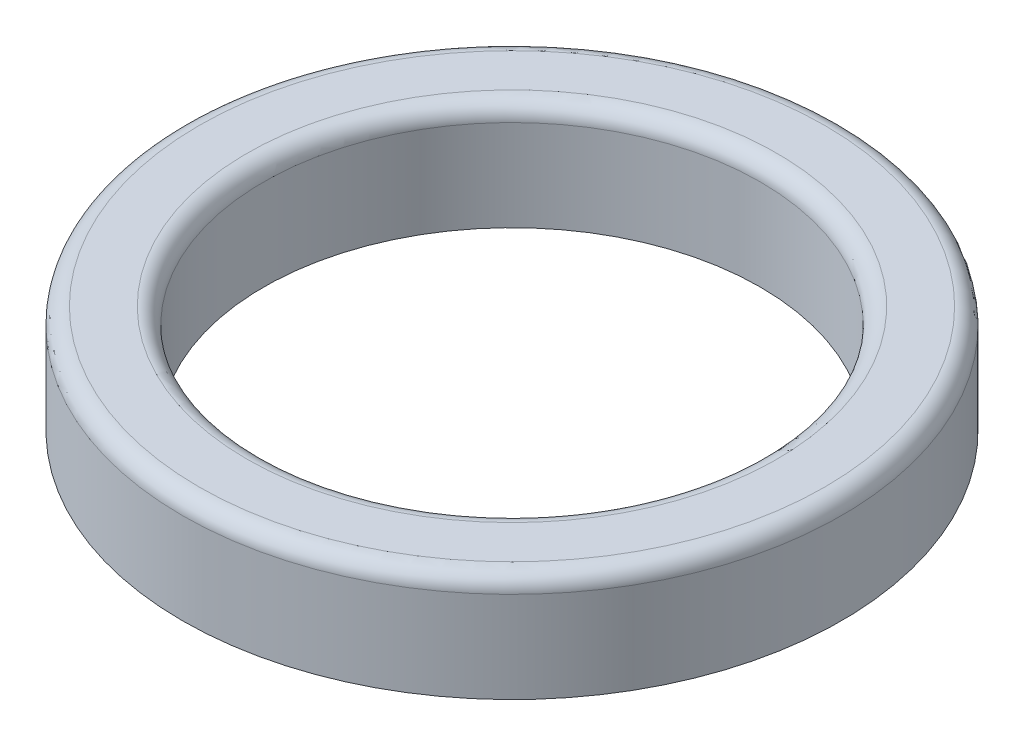
from build123d import *

# Parameters (mm, degrees)
SKETCH1_R           = 19.9
SKETCH1_R_2         = 15
BOSS_EXTRUDE2_DEPTH = 6.5
FILLET1_R           = 1


with BuildPart() as part:
    # Sketch1 → Boss-Extrude2 (new body)
    with BuildSketch(Plane(origin=(0, 0, 0), x_dir=(1, 0, 0), z_dir=(0, 1, 0))):
        Circle(SKETCH1_R)
        Circle(SKETCH1_R_2, mode=Mode.SUBTRACT)
    extrude(amount=BOSS_EXTRUDE2_DEPTH)

    # Fillet1
    fillet1_edges = [part.edges().sort_by_distance(p)[0] for p in [
        (-15, 6.5, 0),
        (-19.9, 6.5, 0),
    ]]
    fillet(fillet1_edges, radius=FILLET1_R)


solid = part.part
